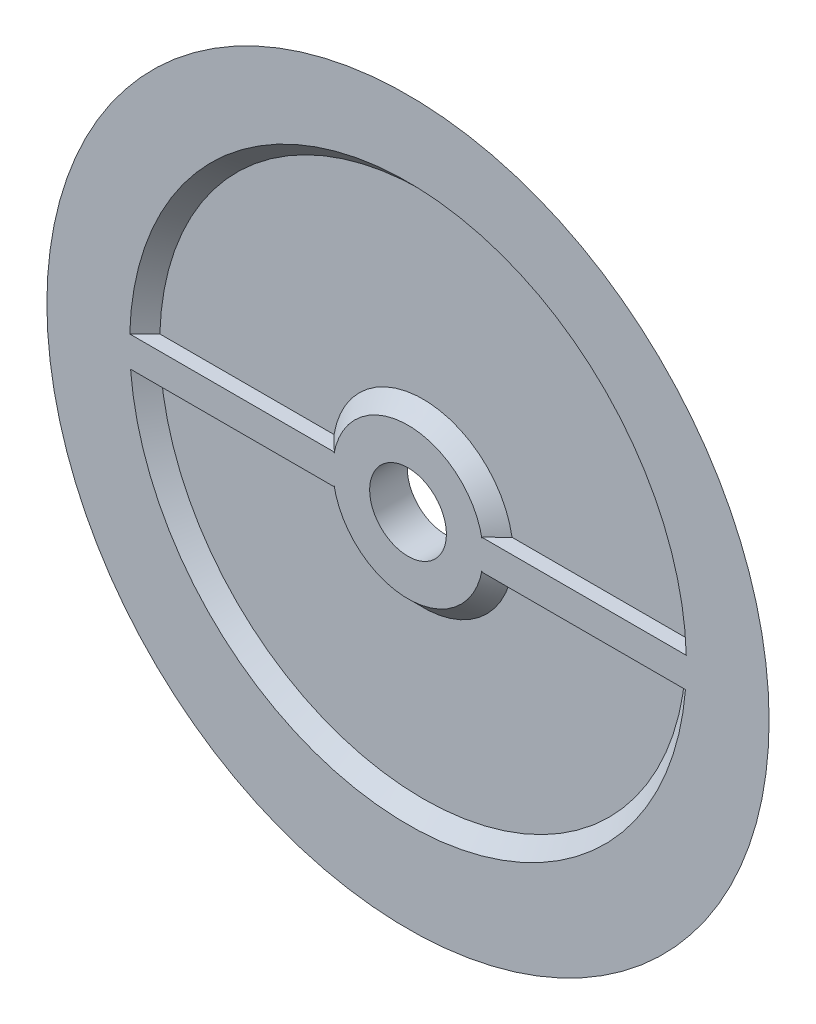
from build123d import *

# Parameters (mm, degrees)
SKETCH_1_R               = 37
EXTRUDE_1_DEPTH          = 5
SKETCH_4_R               = 34.4
SKETCH_4_R_2             = 30.4
EXTRUDE_2_DEPTH          = 0.8
SKETCH_5_R               = 5.1
CUT_EXTRUDE_1_DEPTH      = 69.066144301
SKETCH_6_R               = 37
SKETCH_6_R_2             = 10
CUT_EXTRUDE_2_DEPTH      = 2
CUT_EXTRUDE_2_DRAFT      = -45
SKETCH_7_W               = 25.320983541
SKETCH_7_H               = 4
EXTRUDE_3_DEPTH          = 2
SKETCH_9_W               = 2
SKETCH_9_H               = 4
EXTRUDE_5_DEPTH          = 5
PATTERN_CIRCULAR_1_COUNT = 2


with BuildPart() as part:
    # 스케치1 → 보스-돌출1 (new body)
    with BuildSketch(Plane.XY):
        Circle(SKETCH_1_R)
    extrude(amount=EXTRUDE_1_DEPTH)

    # 스케치3 → 회전1 (revolve)
    with BuildSketch(Plane(origin=(0, 0, 0), x_dir=(1, 0, 0), z_dir=(0, 1, 0))):
        Polygon((-37, -5), (-37, 0), (-48, -5), align=None)
    revolve(axis=Axis((0, 0, -6.462572401), (0, 0, 1)))

    # 스케치4 → 보스-돌출2 (add)
    with BuildSketch(Plane(origin=(0, 0, 0), x_dir=(-1, 0, 0), z_dir=(0, 0, -1))):
        Circle(SKETCH_4_R)
        Circle(SKETCH_4_R_2, mode=Mode.SUBTRACT)
    extrude(amount=EXTRUDE_2_DEPTH)

    # 스케치5 → 컷-돌출1 (cut, through all)
    with BuildSketch(Plane(origin=(0, 0, 0), x_dir=(-1, 0, 0), z_dir=(0, 0, -1))):
        Circle(SKETCH_5_R)
    extrude(amount=-CUT_EXTRUDE_1_DEPTH, mode=Mode.SUBTRACT)


with BuildPart() as cut_extrude_2_tool:
    # 스케치6 → 컷-돌출2 (with draft: the straight prism first)
    with BuildSketch(Plane.XY.offset(5)):
        with Locations((0, 0.990500037)):
            Circle(SKETCH_6_R)
        Circle(SKETCH_6_R_2, mode=Mode.SUBTRACT)
    extrude(amount=-CUT_EXTRUDE_2_DEPTH)
    # 컷-돌출2: the draft: its side faces are tilted about the plane it starts from
    cut_extrude_2_sides = [cut_extrude_2_tool.faces().sort_by_distance(p)[0] for p in [
        (-37, 0.990500037, 4),
        (-10, 0, 4),
    ]]
    draft(cut_extrude_2_sides, Plane.XY.offset(5), CUT_EXTRUDE_2_DRAFT)


with BuildPart() as part_1:
    add(part.part)

    # 컷-돌출2: cut by cut_extrude_2_tool
    add(cut_extrude_2_tool.part, mode=Mode.SUBTRACT)

    # 스케치7 → 보스-돌출3 (add)
    with BuildSketch(Plane.XY.offset(5)):
        with Locations((-27.526560518, 0)):
            Rectangle(SKETCH_7_W, SKETCH_7_H)
    extrude_3 = extrude(amount=-EXTRUDE_3_DEPTH)

    # 스케치9 → 보스-돌출5 (add)
    with BuildSketch(Plane(origin=(-14.866068747, 0, 0), x_dir=(0, 0, -1), z_dir=(1, 0, 0))):
        with Locations((-4, 0)):
            Rectangle(SKETCH_9_W, SKETCH_9_H)
    extrude_5 = extrude(amount=EXTRUDE_5_DEPTH)

    # 원형 패턴1: 보스-돌출3, 보스-돌출5 ×2 about axis
    pattern_circular_1_axis = Axis((0, 0, -37.34250157), (0, 0, 1))
    add([extrude_3.rotate(pattern_circular_1_axis, i * 360 / PATTERN_CIRCULAR_1_COUNT) for i in range(1, PATTERN_CIRCULAR_1_COUNT)])
    add([extrude_5.rotate(pattern_circular_1_axis, i * 360 / PATTERN_CIRCULAR_1_COUNT) for i in range(1, PATTERN_CIRCULAR_1_COUNT)])


solid = part_1.part
